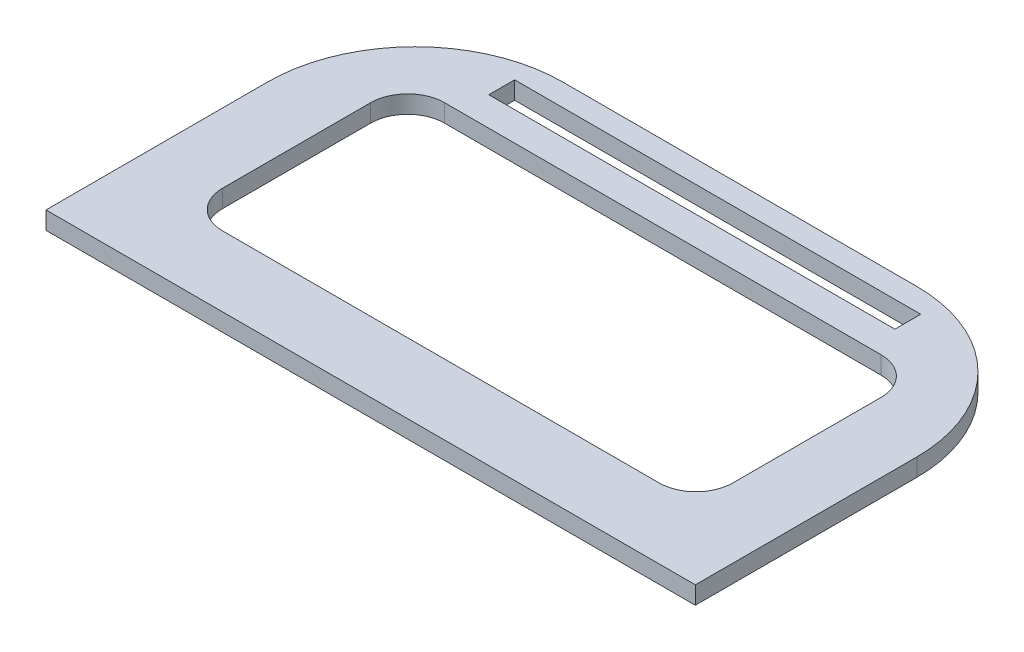
from build123d import *

# Parameters (mm, degrees)
SKETCH1_W           = 8.795086316
SKETCH1_H           = 5
SKETCH1_W_2         = 5.5
SKETCH1_H_2         = 0.35
BOSS_EXTRUDE1_DEPTH = 0.24
FILLET1_R           = 2
SKETCH2_W           = 6.913332482
SKETCH2_H           = 3.007207861
CUT_EXTRUDE1_DEPTH  = 11.119839095
FILLET4_R           = 0.5


with BuildPart() as part:
    # Sketch1 → Boss-Extrude1 (new body)
    with BuildSketch(Plane(origin=(0, 0, 0), x_dir=(1, 0, 0), z_dir=(0, 1, 0))):
        with Locations((4.397543158, 2.5)):
            Rectangle(SKETCH1_W, SKETCH1_H)
        with Locations((4.397543158, 4.525)):
            Rectangle(SKETCH1_W_2, SKETCH1_H_2, mode=Mode.SUBTRACT)
    extrude(amount=BOSS_EXTRUDE1_DEPTH)

    # Fillet1
    fillet1_edges = [part.edges().sort_by_distance(p)[0] for p in [
        (8.795086316, 0.12, -5),
        (0, 0.12, -5),
    ]]
    fillet(fillet1_edges, radius=FILLET1_R)

    # Sketch2 → Cut-Extrude1 (cut, through all)
    with BuildSketch(Plane(origin=(0, 0.24, 0), x_dir=(1, 0, 0), z_dir=(0, 1, 0))):
        with Locations((4.397543158, 2.453300335)):
            Rectangle(SKETCH2_W, SKETCH2_H)
    extrude(amount=-CUT_EXTRUDE1_DEPTH, mode=Mode.SUBTRACT)

    # Fillet4
    fillet4_edges = [part.edges().sort_by_distance(p)[0] for p in [
        (7.854209399, 0.12, -0.949696404),
        (7.854209399, 0.12, -3.956904265),
        (0.940876917, 0.12, -3.956904265),
        (0.940876917, 0.12, -0.949696404),
    ]]
    fillet(fillet4_edges, radius=FILLET4_R)


solid = part.part
